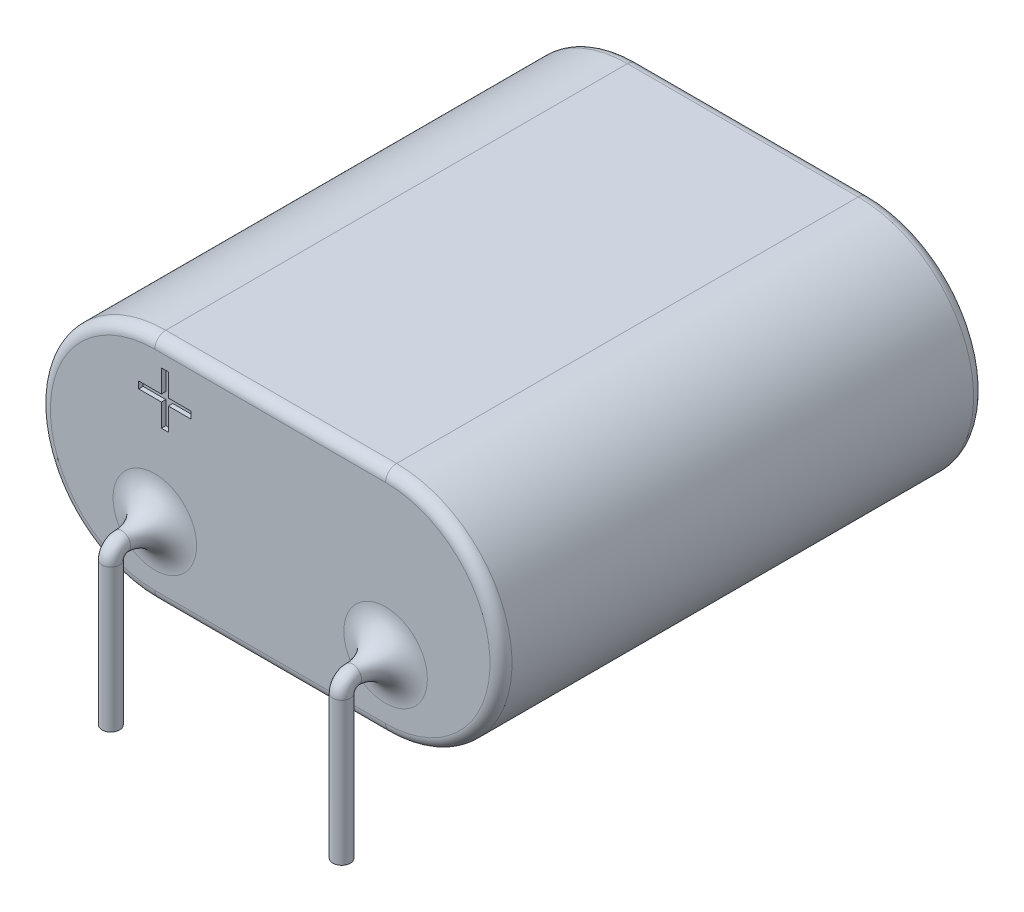
from build123d import *

# Parameters (mm, degrees)
BOSS_EXTRUDE1_DEPTH = 22
SKETCH2_R           = 0.4
FILLET1_R           = 1.5
FILLET2_R           = 0.5
CUT_EXTRUDE1_DEPTH  = 0.2


with BuildPart() as part:
    # Sketch1 → Boss-Extrude1 (new body)
    with BuildSketch(Plane.XY):
        with BuildLine():
            Line((0, 5.25), (10.5, 5.25))
            ThreePointArc((10.5, 5.25), (15.75, 0), (10.5, -5.25))
            Line((10.5, -5.25), (0, -5.25))
            ThreePointArc((0, -5.25), (-5.25, 0), (0, 5.25))
        make_face()
    extrude(amount=-BOSS_EXTRUDE1_DEPTH)

    # Sweep1: sweep along a path in Sketch3
    with BuildLine(Plane.YZ) as sweep1_path:
        Line((-2.05, 0), (-2.05, 1.5))
        ThreePointArc((-2.05, 1.5), (-2.196446609, 1.853553391), (-2.55, 2))
        Line((-2.55, 2), (-9.05, 2))
    # Sketch2 → Sweep1 (sweep)
    with BuildSketch(Plane.XY):
        with Locations((0, -2.05)):
            Circle(SKETCH2_R)
        with Locations((10.5, -2.05)):
            Circle(SKETCH2_R)
    sweep(path=sweep1_path.line)

    # Fillet1
    fillet1_edges = [part.edges().sort_by_distance(p)[0] for p in [
        (-0.4, -2.05, 0),
        (10.1, -2.05, 0),
    ]]
    fillet(fillet1_edges, radius=FILLET1_R - 0.0001)  # a hair under: the kernel refuses the full size

    # Fillet2
    fillet2_edges = [part.edges().sort_by_distance(p)[0] for p in [
        (15.75, 0, -22),
        (5.25, 5.25, -22),
        (-5.25, 0, -22),
        (5.25, 5.25, 0),
        (15.75, 0, 0),
        (5.25, -5.25, 0),
        (-5.25, 0, 0),
        (5.25, -5.25, -22),
    ]]
    fillet(fillet2_edges, radius=FILLET2_R)

    # Sketch4 → Cut-Extrude1 (cut)
    with BuildSketch(Plane.XY):
        Polygon((0.301282051, 3.134615385), (0.301282051, 4.166666667), (0.615384615, 4.166666667), (0.615384615, 3.134615385), (1.647435897, 3.134615385), (1.647435897, 2.820512821), (0.615384615, 2.820512821), (0.615384615, 1.788461538), (0.301282051, 1.788461538), (0.301282051, 2.820512821), (-0.730769231, 2.820512821), (-0.730769231, 3.134615385), align=None)
    extrude(amount=-CUT_EXTRUDE1_DEPTH, mode=Mode.SUBTRACT)


solid = part.part
